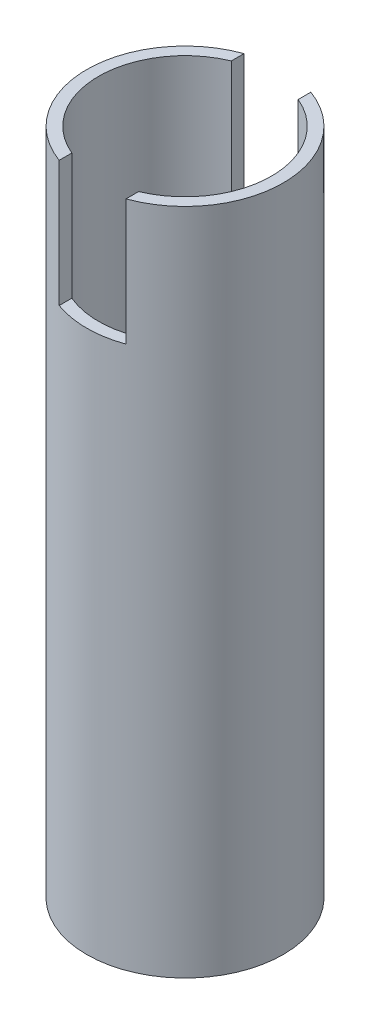
from build123d import *

# Parameters (mm, degrees)
ESBO_O1_R                = 25
ESBO_O1_R_2              = 22
RESSALTO_EXTRUS_O1_DEPTH = 170
CORTE_EXTRUS_O2_START    = -32
CORTE_EXTRUS_O2_DEPTH    = 32


with BuildPart() as part:
    # Esboço1 → Ressalto-extrusão1 (new body)
    with BuildSketch(Plane(origin=(0, 0, 0), x_dir=(1, 0, 0), z_dir=(0, 1, 0))):
        Circle(ESBO_O1_R)
        Circle(ESBO_O1_R_2, mode=Mode.SUBTRACT)
    extrude(amount=RESSALTO_EXTRUS_O1_DEPTH)

    # Esboço3 → Corte-extrusão2 (cut)
    with BuildSketch(Plane(origin=(0, 170, 0), x_dir=(1, 0, 0), z_dir=(0, 1, 0)).offset(CORTE_EXTRUS_O2_START)):
        with BuildLine():
            Line((8.5, -20.291623888), (8.5, -23.510635891))
            ThreePointArc((8.5, -23.510635891), (0, -25), (-8.5, -23.510635891))
            Line((-8.5, -23.510635891), (-8.5, -20.291623888))
            ThreePointArc((-8.5, -20.291623888), (0, -22), (8.5, -20.291623888))
        make_face()
        with BuildLine():
            Line((-8.5, 23.510635891), (-8.5, 20.291623888))
            ThreePointArc((-8.5, 20.291623888), (0, 22), (8.5, 20.291623888))
            Line((8.5, 20.291623888), (8.5, 23.510635891))
            ThreePointArc((8.5, 23.510635891), (0, 25), (-8.5, 23.510635891))
        make_face()
    extrude(amount=CORTE_EXTRUS_O2_DEPTH, mode=Mode.SUBTRACT)


solid = part.part
